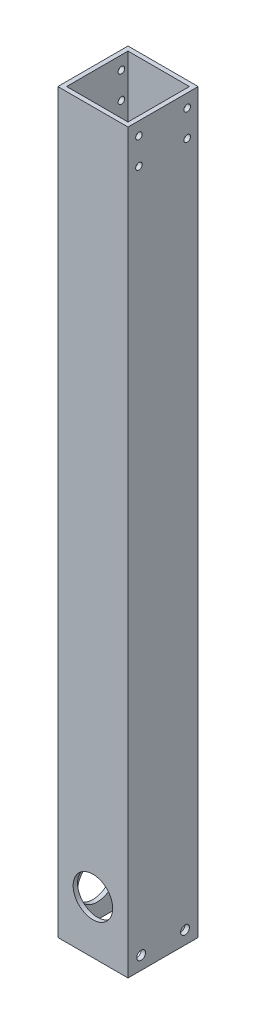
from build123d import *

# Parameters (mm, degrees)
SKETCH1_W           = 50.8
SKETCH1_H           = 50.8
SKETCH1_W_2         = 44.45
SKETCH1_H_2         = 44.45
BOSS_EXTRUDE1_DEPTH = 533.4
SKETCH2_R           = 14.2875
CUT_EXTRUDE1_DEPTH  = 3.175
SKETCH3_R           = 14.3002
CUT_EXTRUDE2_DEPTH  = 537.415286881
SKETCH4_R           = 2.38125
CUT_EXTRUDE3_DEPTH  = 537.415286881
SKETCH5_R           = 3.175
CUT_EXTRUDE4_DEPTH  = 537.415286881


with BuildPart() as part:
    # Sketch1 → Boss-Extrude1 (new body)
    with BuildSketch(Plane(origin=(0, 0, 0), x_dir=(1, 0, 0), z_dir=(0, 1, 0))):
        Rectangle(SKETCH1_W, SKETCH1_H)
        Rectangle(SKETCH1_W_2, SKETCH1_H_2, mode=Mode.SUBTRACT)
    extrude(amount=BOSS_EXTRUDE1_DEPTH)

    # Sketch2 → Cut-Extrude1 (cut)
    with BuildSketch(Plane.ZY.offset(25.4)):
        with Locations((0, 25.4)):
            Circle(SKETCH2_R)
    extrude(amount=-CUT_EXTRUDE1_DEPTH, mode=Mode.SUBTRACT)

    # Sketch3 → Cut-Extrude2 (cut, through all)
    with BuildSketch(Plane(origin=(0, 0, -25.4), x_dir=(-1, 0, 0), z_dir=(0, 0, -1))):
        with Locations((0, 38.1)):
            Circle(SKETCH3_R)
    extrude(amount=-CUT_EXTRUDE2_DEPTH, mode=Mode.SUBTRACT)

    # Sketch4 → Cut-Extrude3 (cut, through all)
    with BuildSketch(Plane.ZY.offset(25.4)):
        with Locations((17.4625, 523.875)):
            Circle(SKETCH4_R)
        with Locations((17.4625, 504.825)):
            Circle(SKETCH4_R)
        with Locations((-17.4625, 504.825)):
            Circle(SKETCH4_R)
        with Locations((-17.4625, 523.875)):
            Circle(SKETCH4_R)
    extrude(amount=-CUT_EXTRUDE3_DEPTH, mode=Mode.SUBTRACT)

    # Sketch5 → Cut-Extrude4 (cut, through all)
    with BuildSketch(Plane.ZY.offset(25.4)):
        with Locations((-15.875, 9.525)):
            Circle(SKETCH5_R)
        with Locations((15.875, 9.525)):
            Circle(SKETCH5_R)
    extrude(amount=-CUT_EXTRUDE4_DEPTH, mode=Mode.SUBTRACT)


solid = part.part
